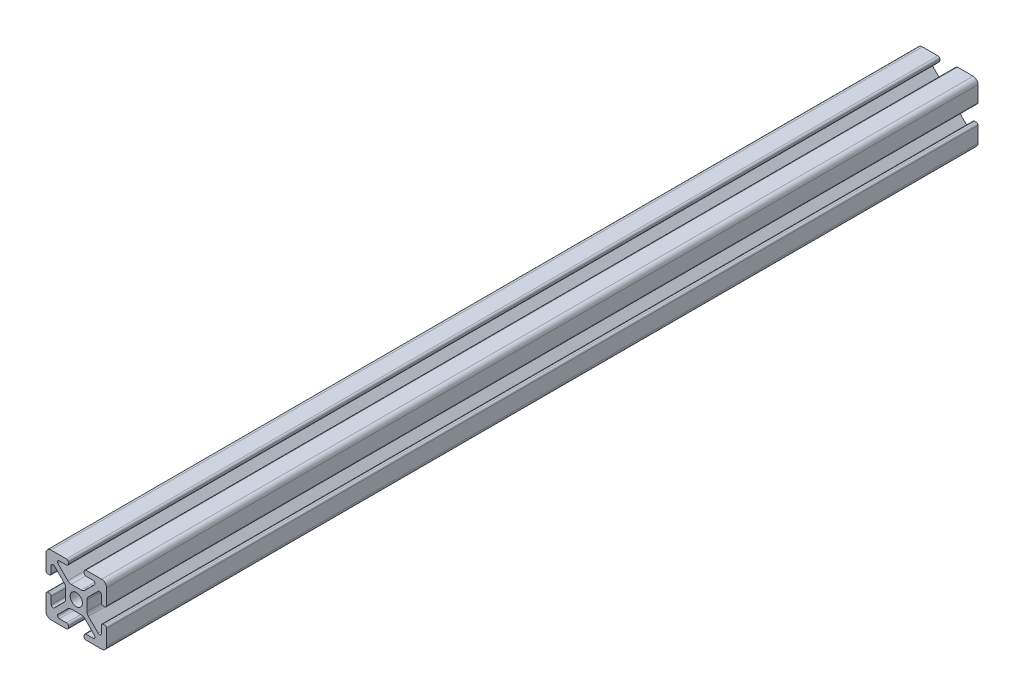
from build123d import *

# Parameters (mm, degrees)
SKETCH2_W            = 8.76
SKETCH2_H            = 8.76
SKETCH2_R            = 2.5
BOSS_EXTRUDE1_DEPTH  = 177.8
BOSS_EXTRUDE2_START  = -177.8
BOSS_EXTRUDE2_DEPTH  = 355.6
FILLET1_R            = 0.75
FILLET1_OF_MIRROR1_R = 0.75
MIRROR2_START        = -177.8
MIRROR2_DEPTH        = 355.6
FILLET2_R            = 2


# Read off the part's stored shape, not the designer's step: Mirror2
with BuildPart() as part:
    # Sketch2 → Boss-Extrude1 (new, symmetric)
    with BuildSketch(Plane.XY):
        Rectangle(SKETCH2_W, SKETCH2_H)
        Circle(SKETCH2_R, mode=Mode.SUBTRACT)
    extrude(amount=BOSS_EXTRUDE1_DEPTH, both=True)

    # Sketch3 → Boss-Extrude2 (add)
    with BuildSketch(Plane.XY.offset(BOSS_EXTRUDE2_START)):
        Polygon((3.25, 12.35), (12.35, 12.35), (12.35, 3.25), (10.22, 3.25), (10.22, 8.713862556), (4.38, 2.873862556), (4.38, 4.38), (2.873862556, 4.38), (8.713862556, 10.22), (3.25, 10.22), align=None)
    boss_extrude2 = extrude(amount=BOSS_EXTRUDE2_DEPTH)

    # Fillet1
    fillet1_edges = [part.edges().sort_by_distance(p)[0] for p in [
        (3.25, 12.35, 0),
        (3.25, 10.22, 0),
        (8.713862556, 10.22, 0),
        (10.22, 8.713862556, 0),
        (10.22, 3.25, 0),
        (12.35, 3.25, 0),
    ]]
    fillet(fillet1_edges, radius=FILLET1_R)

    # Mirror1: Boss-Extrude2 across plane
    add(boss_extrude2.mirror(Plane.ZX))

    # Fillet1 of Mirror1
    fillet1_of_mirror1_edges = [part.edges().sort_by_distance(p)[0] for p in [
        (3.25, -12.35, 0),
        (3.25, -10.22, 0),
        (8.713862556, -10.22, 0),
        (10.22, -8.713862556, 0),
        (10.22, -3.25, 0),
        (12.35, -3.25, 0),
    ]]
    fillet(fillet1_of_mirror1_edges, radius=FILLET1_OF_MIRROR1_R)

    # Mirror2 outline → Mirror2 (add)
    with BuildSketch(Plane.XY.offset(MIRROR2_START)):
        with BuildLine():
            ThreePointArc((-7.43353247, 8.939669914), (-7.596112034, 9.757012574), (-6.903202384, 10.22))
            Line((-6.903202384, 10.22), (-4, 10.22))
            ThreePointArc((-4, 10.22), (-3.469669914, 10.439669914), (-3.25, 10.97))
            Line((-3.25, 10.97), (-3.25, 11.6))
            ThreePointArc((-3.25, 11.6), (-3.469669914, 12.130330086), (-4, 12.35))
            Line((-4, 12.35), (-12.35, 12.35))
            Line((-12.35, 12.35), (-12.35, 4))
            ThreePointArc((-12.35, 4), (-12.130330086, 3.469669914), (-11.6, 3.25))
            Line((-11.6, 3.25), (-10.97, 3.25))
            ThreePointArc((-10.97, 3.25), (-10.439669914, 3.469669914), (-10.22, 4))
            Line((-10.22, 4), (-10.22, 6.903202384))
            ThreePointArc((-10.22, 6.903202384), (-9.757012574, 7.596112034), (-8.939669914, 7.43353247))
            Line((-8.939669914, 7.43353247), (-4.38, 2.873862556))
            Line((-4.38, 2.873862556), (-4.38, 4.38))
            Line((-4.38, 4.38), (-2.873862556, 4.38))
            Line((-2.873862556, 4.38), (-7.43353247, 8.939669914))
        make_face()
        with BuildLine():
            Line((-4.38, -4.38), (-4.38, -2.873862556))
            Line((-4.38, -2.873862556), (-8.939669914, -7.43353247))
            ThreePointArc((-8.939669914, -7.43353247), (-9.757012574, -7.596112034), (-10.22, -6.903202384))
            Line((-10.22, -6.903202384), (-10.22, -4))
            ThreePointArc((-10.22, -4), (-10.439669914, -3.469669914), (-10.97, -3.25))
            Line((-10.97, -3.25), (-11.6, -3.25))
            ThreePointArc((-11.6, -3.25), (-12.130330086, -3.469669914), (-12.35, -4))
            Line((-12.35, -4), (-12.35, -12.35))
            Line((-12.35, -12.35), (-4, -12.35))
            ThreePointArc((-4, -12.35), (-3.469669914, -12.130330086), (-3.25, -11.6))
            Line((-3.25, -11.6), (-3.25, -10.97))
            ThreePointArc((-3.25, -10.97), (-3.469669914, -10.439669914), (-4, -10.22))
            Line((-4, -10.22), (-6.903202384, -10.22))
            ThreePointArc((-6.903202384, -10.22), (-7.596112034, -9.757012574), (-7.43353247, -8.939669914))
            Line((-7.43353247, -8.939669914), (-2.873862556, -4.38))
            Line((-2.873862556, -4.38), (-4.38, -4.38))
        make_face()
    extrude(amount=MIRROR2_DEPTH)

    # Fillet2
    fillet2_edges = [part.edges().sort_by_distance(p)[0] for p in [
        (-2.873862556, -4.38, 0),
        (-4.38, -2.873862556, 0),
        (-12.35, -12.35, 0),
        (2.873862556, 4.38, 0),
        (4.38, 2.873862556, 0),
        (12.35, 12.35, 0),
        (-2.873862556, 4.38, 0),
        (-4.38, 2.873862556, 0),
        (-12.35, 12.35, 0),
        (2.873862556, -4.38, 0),
        (4.38, -2.873862556, 0),
        (12.35, -12.35, 0),
    ]]
    fillet(fillet2_edges, radius=FILLET2_R)


solid = part.part
